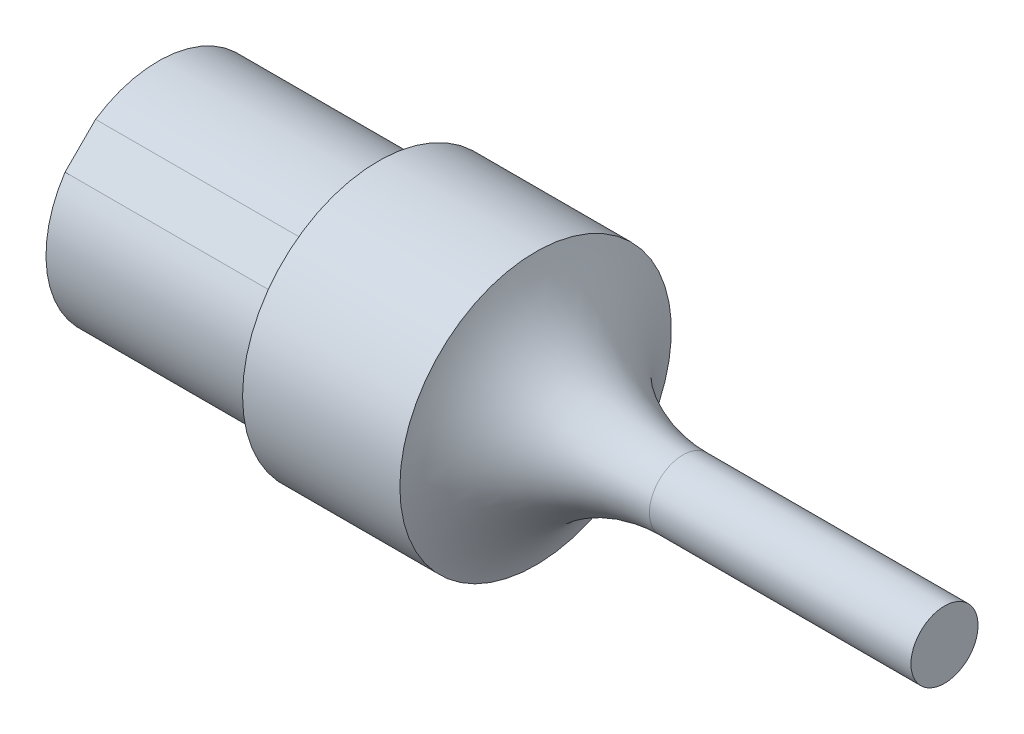
from build123d import *

# Parameters (mm, degrees)
SKETCH_1_W          = 14
SKETCH_1_H          = 7.133094656938376
FILLET_1_R          = 10
CUT_EXTRUDE_1_DEPTH = 14


with BuildPart() as part:
    # 草图1 → 旋转1 (revolve)
    with BuildSketch(Plane(origin=(0, 0, 0), x_dir=(1, 0, 0), z_dir=(0, 1, 0)), mode=Mode.PRIVATE) as revolve_1_sk:
        with Locations((-25.681968733439298, 2.0314918872170904)):
            Rectangle(SKETCH_1_W, SKETCH_1_H)
        Polygon((-18.681968733439298, 5.598039215686279), (-18.681968733439298, -1.535055441252097), (-8.681968733439298, -1.5350554412520978), (-8.681968733439302, 0.5980392156862795), (-8.681968733439302, 7.098039215686279), (-18.681968733439298, 7.098039215686279), align=None)
        Polygon((-8.681968733439302, 0.5980392156862795), (-8.681968733439302, -1.535055441252097), (17.318031266560702, -1.5350554412520978), (17.318031266560705, 0.5980392156862795), align=None)
    revolve(revolve_1_sk.sketch.rotate(Axis((-32.6819687334393, 0, 1.5350554412520978), (1, 0, 0)), 180), axis=Axis((-32.6819687334393, 0, 1.5350554412520978), (1, 0, 0)))

    # 圆角1
    # the kernel refuses this fillet: 10 mm, written as the material it adds along each edge
    with BuildSketch(Plane(origin=(-8.681968733439302, 0, 1.5350554412520978), x_dir=(0, 1.2e-16, 1), z_dir=(0, 1, -1.2e-16))) as fillet_1_piece_1:
        with BuildLine():
            CenterArc((12.133094656938377, 9.367496997597598), FILLET_1_R, 180, 69.51268488527734)
            Line((2.1330946569383773, 9.367496997597598), (1.9330946569383771, 9.367496997597598))
            Line((1.9330946569383771, 9.367496997597598), (1.9330946569383771, 0))
            Line((1.9330946569383771, 0), (2.1330946569383773, -0.1999999999999993))
            ThreePointArc((2.1330946569383773, -0.1999999999999993), (5.383094656938376, -0.1999999999999993), (8.563094656938375, -0.18734993995195026))
            Line((8.563094656938375, -0.18734993995195026), (8.633094656938376, 1.78e-15))
        make_face()
    revolve(axis=Axis((-8.681968733439302, 0, 1.5350554412520978), (1, 0, 0)))

    # 草图2 → 切除-拉伸-薄壁1 (cut)
    with BuildSketch(Plane.ZY.offset(32.6819687334393)):
        Polygon((5.514998964205359, 5.919551413658403), (7.454606854910501, 3.979943522953262), (14.525674666775975, 11.051011334818739), (12.586066776070833, 12.99061922552388), align=None)
    extrude(amount=-CUT_EXTRUDE_1_DEPTH, mode=Mode.SUBTRACT)


solid = part.part
